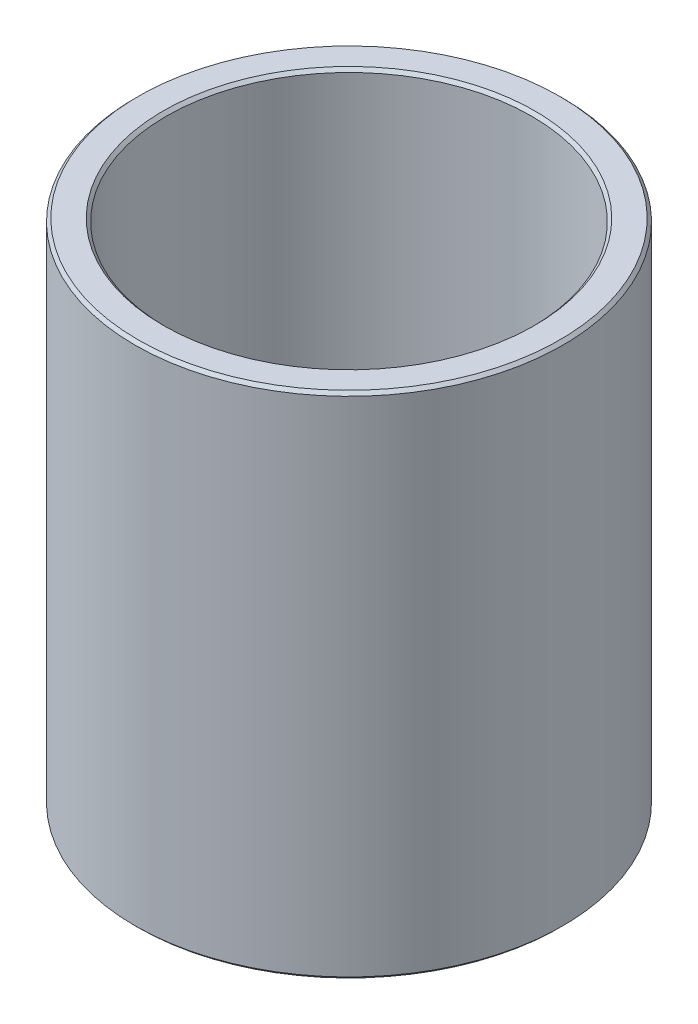
from build123d import *

# Parameters (mm, degrees)
SKETCH1_R           = 40
BOSS_EXTRUDE1_DEPTH = 95.175412464
SKETCH2_R           = 34.168994091
CUT_EXTRUDE1_DEPTH  = 111.717474401
CHAMFER1_SIZE       = 0.574226103


with BuildPart() as part:
    # Sketch1 → Boss-Extrude1 (new body)
    with BuildSketch(Plane(origin=(0, 0, 0), x_dir=(1, 0, 0), z_dir=(0, 1, 0))):
        Circle(SKETCH1_R)
    extrude(amount=BOSS_EXTRUDE1_DEPTH)

    # Sketch2 → Cut-Extrude1 (cut, through all)
    with BuildSketch(Plane(origin=(0, 0, 0), x_dir=(1, 0, 0), z_dir=(0, 1, 0))):
        Circle(SKETCH2_R)
    extrude(amount=CUT_EXTRUDE1_DEPTH, mode=Mode.SUBTRACT)

    # Chamfer1
    chamfer1_edges = [part.edges().sort_by_distance(p)[0] for p in [
        (-34.168994091, 95.175412464, 0),
        (-34.168994091, 0, 0),
        (-40, 0, 0),
        (-40, 95.175412464, 0),
    ]]
    chamfer(chamfer1_edges, length=CHAMFER1_SIZE)


solid = part.part
